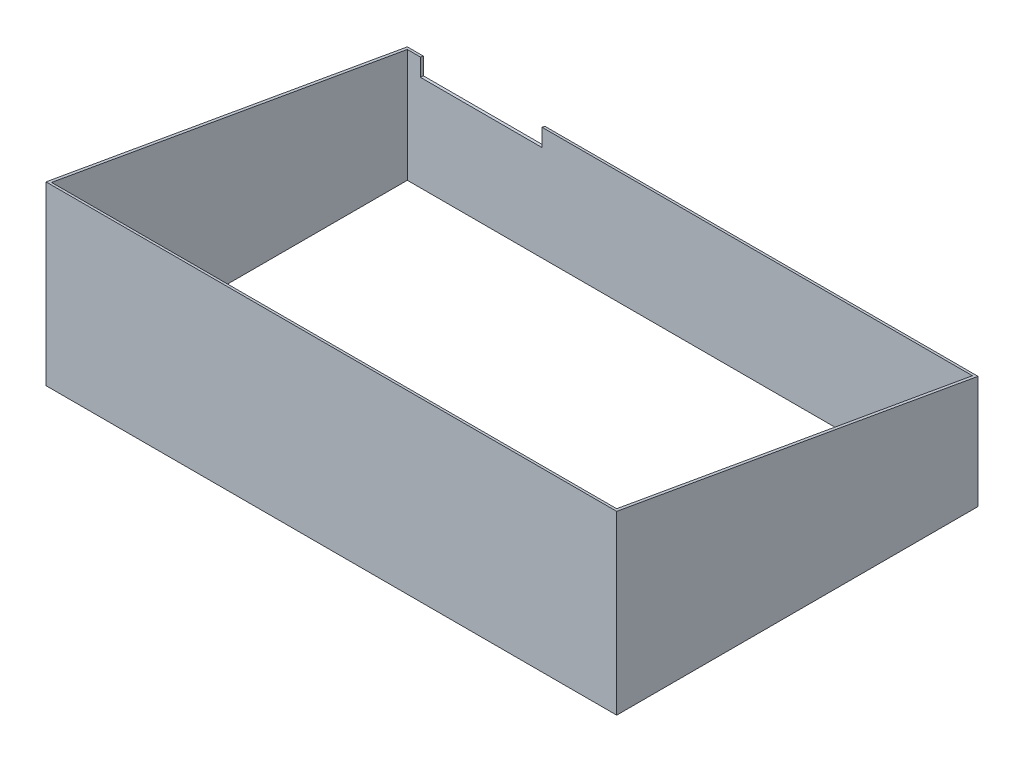
from build123d import *

# Parameters (mm, degrees)
BOSS_EXTRUDE1_DEPTH = 1300
SHELL1_T            = -6.35
CUT_EXTRUDE2_REACH  = 1589.044
SKETCH3_W           = 277
SKETCH3_H           = 50


with BuildPart() as part:
    # Sketch1 → Boss-Extrude1 (new body)
    with BuildSketch(Plane(origin=(0, 0, 0), x_dir=(0, 0, -1), z_dir=(1, 0, 0))):
        Polygon((0, 402.126464485), (0, 0), (823.05307958, 0), (823.05307958, 257), align=None)
    extrude(amount=BOSS_EXTRUDE1_DEPTH)

    # Shell1
    shell1_openings = [part.faces().sort_by_distance(p)[0] for p in [
        (650, 0, -411.52653979),
        (650, 329.563232243, -411.52653979),
    ]]
    offset(amount=SHELL1_T, openings=shell1_openings, kind=Kind.INTERSECTION)

    # Sketch3 → Cut-Extrude2 (cut, up to next)
    with BuildSketch(Plane.XY.offset(-816.70307958), mode=Mode.PRIVATE) as cut_extrude2_sk1:
        with Locations((174.85, 243.119676327)):
            Rectangle(SKETCH3_W, SKETCH3_H)
    cut_extrude2_tool1 = extrude(cut_extrude2_sk1.sketch, amount=-CUT_EXTRUDE2_REACH, mode=Mode.PRIVATE) & part.part
    add(cut_extrude2_tool1.solids().sort_by_distance((174.85, 243.119676, -816.70308))[0], mode=Mode.SUBTRACT)


solid = part.part
